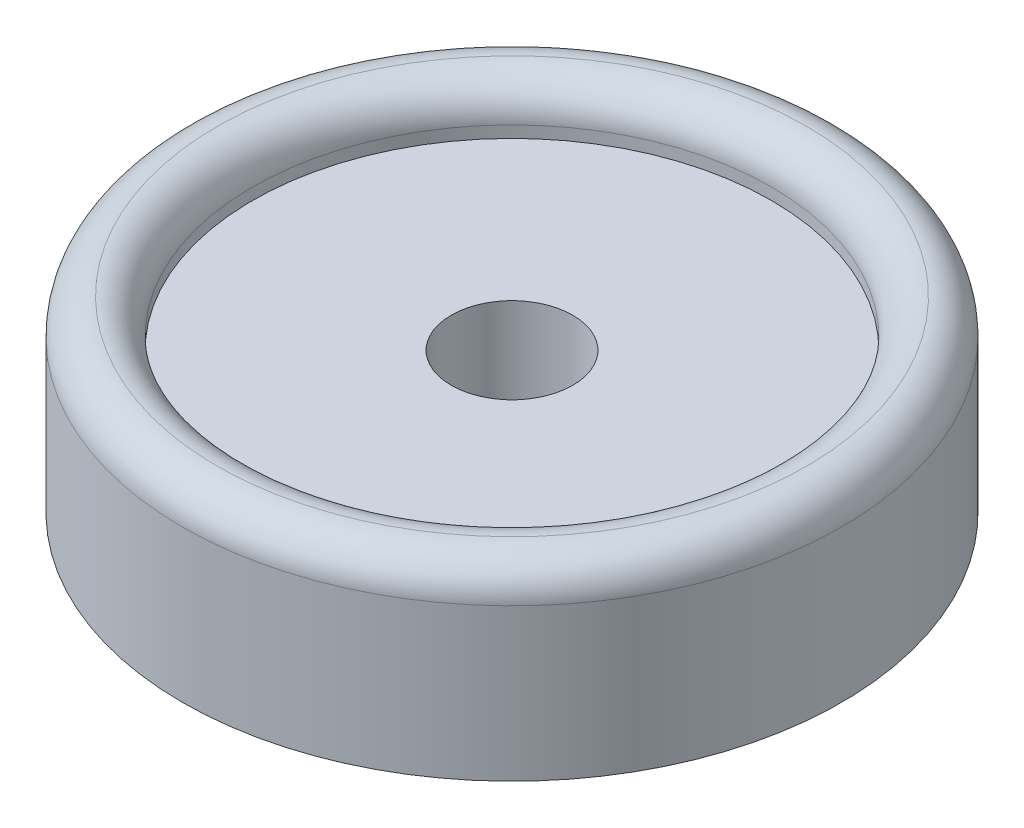
from build123d import *

# Parameters (mm, degrees)
SKETCH1_R               = 11.1
SKETCH1_R_2             = 8.1
BOSS_EXTRUDE1_DEPTH     = 50
SKETCH3_W               = 203.170281232
SKETCH3_H               = 205.602397066
CUT_EXTRUDE1_DEPTH      = 53.406297332
SKETCH4_R               = 11.1
BOSS_EXTRUDE3_DEPTH     = 3
CUT_EXTRUDE2_DEPTH      = 99.261996723
CUT_EXTRUDE2_DEPTH_BACK = 99.261996723
SKETCH5_R               = 2.6
SKETCH6_W               = 15
SKETCH6_H               = 30
BOSS_EXTRUDE4_DEPTH     = 1.5
CUT_EXTRUDE3_DEPTH      = 60.691875494
CUT_EXTRUDE3_DEPTH_BACK = 60.691875494
SKETCH7_W               = 115.313009773
SKETCH7_H               = 104.745429411
BOSS_EXTRUDE5_START     = -8
SKETCH8_R               = 14.1
SKETCH8_R_2             = 11.1
BOSS_EXTRUDE5_DEPTH     = 8
FILLET3_R               = 1.5


with BuildPart() as part:
    # Sketch1 → Boss-Extrude1 (new, symmetric)
    with BuildSketch(Plane(origin=(0, 0, 0), x_dir=(1, 0, 0), z_dir=(0, 1, 0))):
        with Locations(Location((0, 0, 0), (0, 0, 270))):
            Circle(SKETCH1_R)
        with Locations(Location((0, 0, 0), (0, 0, 270))):
            Circle(SKETCH1_R_2, mode=Mode.SUBTRACT)
    extrude(amount=BOSS_EXTRUDE1_DEPTH, both=True)

    # Sketch3 → Cut-Extrude1 (cut, through all)
    with BuildSketch(Plane.XY):
        Rectangle(SKETCH3_W, SKETCH3_H)
    extrude(amount=CUT_EXTRUDE1_DEPTH, mode=Mode.SUBTRACT)

    # Sketch4 → Boss-Extrude3 (add, symmetric)
    with BuildSketch(Plane.XZ.offset(50)):
        with Locations(Location((0, 0, 0), (0, 0, 270))):
            Circle(SKETCH4_R)
    extrude(amount=BOSS_EXTRUDE3_DEPTH, both=True)

    # Sketch5 → Cut-Extrude2 (cut, two sides: drawn at the far end of the back side and taken through both)
    with BuildSketch(Plane(origin=(0, -47, 0), x_dir=(1, 0, 0), z_dir=(0, 1, 0)).offset(-CUT_EXTRUDE2_DEPTH_BACK)):
        with Locations(Location((0, 0, 0), (0, 0, 270))):
            Circle(SKETCH5_R)
    extrude(amount=CUT_EXTRUDE2_DEPTH + CUT_EXTRUDE2_DEPTH_BACK, mode=Mode.SUBTRACT)

    # Sketch6 → Boss-Extrude4 (add, symmetric)
    with BuildSketch(Plane.XY.offset(-6)):
        with Locations((15.1, 25)):
            Rectangle(SKETCH6_W, SKETCH6_H)
        with Locations((-15.1, 25)):
            Rectangle(SKETCH6_W, SKETCH6_H)
    extrude(amount=BOSS_EXTRUDE4_DEPTH, both=True)

    # Sketch7 → Cut-Extrude3 (cut, two sides: drawn at the far end of the back side and taken through both)
    with BuildSketch(Plane.XY.offset(-4.5).offset(-CUT_EXTRUDE3_DEPTH_BACK)):
        with Locations((3.022672806, 5.372714706)):
            Rectangle(SKETCH7_W, SKETCH7_H)
    extrude(amount=CUT_EXTRUDE3_DEPTH + CUT_EXTRUDE3_DEPTH_BACK, mode=Mode.SUBTRACT)

    # Sketch8 → Boss-Extrude5 (add)
    with BuildSketch(Plane.XZ.offset(53).offset(BOSS_EXTRUDE5_START)):
        with Locations(Location((0, 0, 0), (0, 0, 270))):
            Circle(SKETCH8_R)
        with Locations(Location((0, 0, 0), (0, 0, 270))):
            Circle(SKETCH8_R_2, mode=Mode.SUBTRACT)
    extrude(amount=BOSS_EXTRUDE5_DEPTH)

    # Fillet3
    fillet3_edges = [part.edges().sort_by_distance(p)[0] for p in [
        (0, -45, 14.1),
        (0, -45, 11.1),
    ]]
    fillet(fillet3_edges, radius=FILLET3_R - 0.0001)  # a hair under: the kernel refuses the full size


solid = part.part
